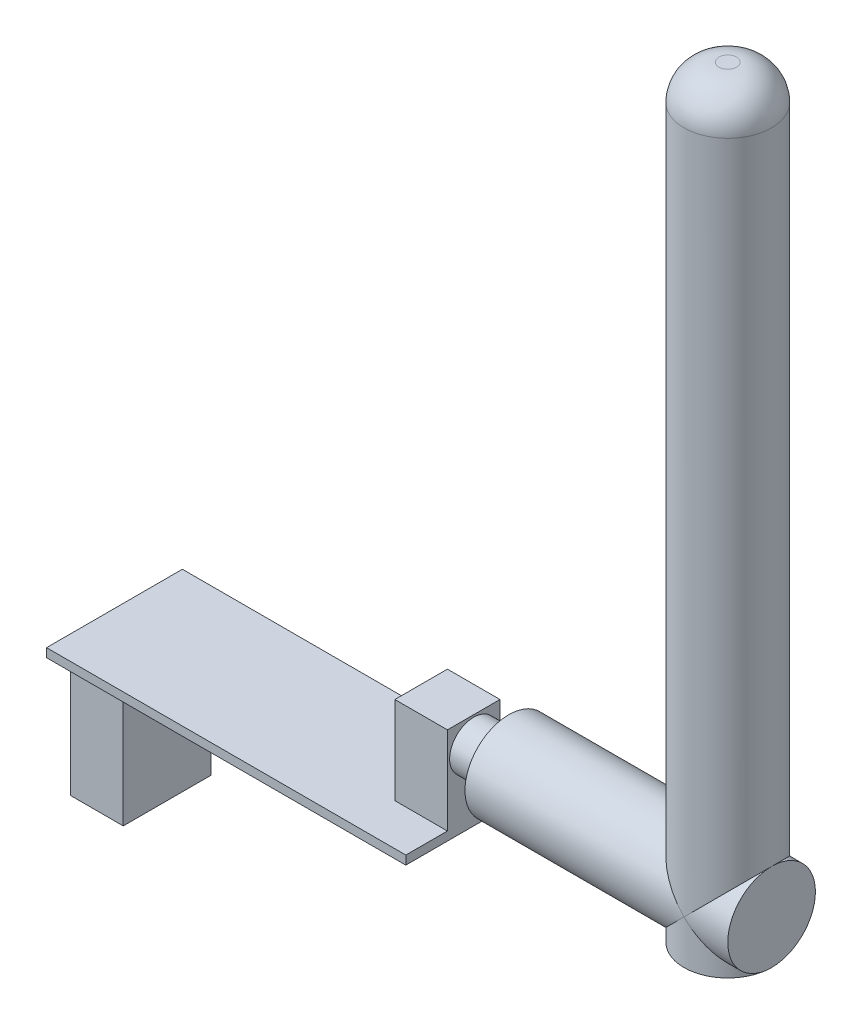
from build123d import *

# Parameters (mm, degrees)
SKETCH_1_W             = 41
SKETCH_1_H             = 15.5
SM_BASE_FLANGE_1_DEPTH = 1
SKETCH_6_W             = 6
SKETCH_6_H             = 6
EXTRUDE_1_DEPTH        = 10
SKETCH_7_R             = 2.75
EXTRUDE_2_DEPTH        = 4
SKETCH_8_R             = 5
EXTRUDE_3_DEPTH        = 30
SKETCH_9_R             = 5
EXTRUDE_4_DEPTH        = 87
FILLET_1_R             = 4
SKETCH_10_W            = 6
SKETCH_10_H            = 10
EXTRUDE_5_DEPTH        = 15


# Sheet-metal steps are written as plain solids
with BuildPart() as part:
    # Sketch 1 → Базовая кромка1 (new body)
    with BuildSketch(Plane(origin=(0, 0, 0), x_dir=(1, 0, 0), z_dir=(0, 1, 0))):
        Rectangle(SKETCH_1_W, SKETCH_1_H)
    extrude(amount=-SM_BASE_FLANGE_1_DEPTH)

    # Эскиз6 → Бобышка-Вытянуть1 (add)
    with BuildSketch(Plane(origin=(0, 0, 0), x_dir=(1, 0, 0), z_dir=(0, 1, 0))):
        with Locations((17.5, 0)):
            Rectangle(SKETCH_6_W, SKETCH_6_H)
    extrude(amount=EXTRUDE_1_DEPTH)

    # Эскиз7 → Бобышка-Вытянуть2 (add)
    with BuildSketch(Plane(origin=(20.5, 0, 0), x_dir=(0, 0, -1), z_dir=(1, 0, 0))):
        with Locations((0, 7)):
            Circle(SKETCH_7_R)
    extrude(amount=EXTRUDE_2_DEPTH)

    # Эскиз8 → Бобышка-Вытянуть3 (add)
    with BuildSketch(Plane(origin=(24.5, 0, 0), x_dir=(0, 0, -1), z_dir=(1, 0, 0))):
        with Locations((0, 7)):
            Circle(SKETCH_8_R)
    extrude(amount=EXTRUDE_3_DEPTH)

    # Эскиз9 → Бобышка-Вытянуть4 (add)
    with BuildSketch(Plane(origin=(0, 2, 0), x_dir=(-1, 0, 0), z_dir=(0, -1, 0))):
        with Locations(Location((-49.5, 0, 0), (0, 0, 90))):
            Circle(SKETCH_9_R)
    extrude(amount=-EXTRUDE_4_DEPTH)

    # Скругление1
    fillet_1_edges = [part.edges().sort_by_distance(p)[0] for p in [
        (49.5, 89, 5),
    ]]
    fillet(fillet_1_edges, radius=FILLET_1_R)

    # Эскиз10 → Бобышка-Вытянуть5 (add)
    with BuildSketch(Plane.XZ.offset(1)):
        with Locations((-17.5, 0)):
            Rectangle(SKETCH_10_W, SKETCH_10_H)
    extrude(amount=EXTRUDE_5_DEPTH)


solid = part.part
